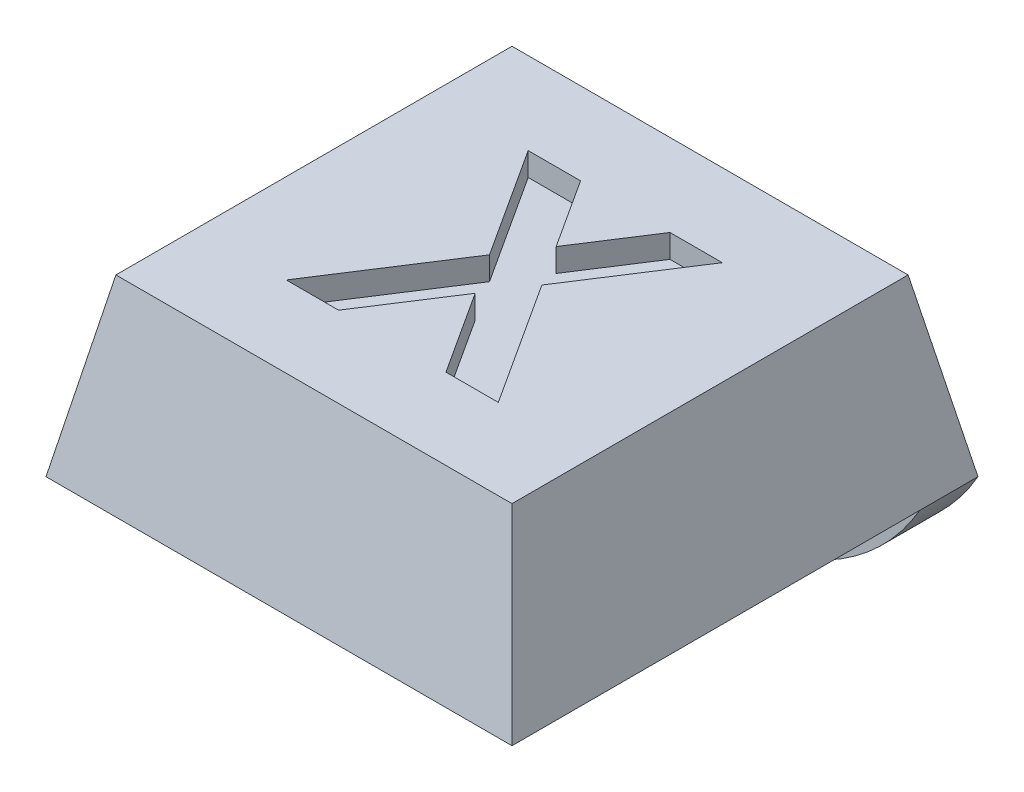
from build123d import *

# Parameters (mm, degrees)
SKETCH1_W               = 8
SKETCH1_H               = 8
BOSS_EXTRUDE1_DEPTH     = 3
CUT_EXTRUDE1_DEPTH      = 12.704699911
CUT_EXTRUDE1_DEPTH_BACK = 12.704699911
CUT_EXTRUDE2_DEPTH      = 11
SKETCH4_R               = 1.8
CUT_EXTRUDE3_DEPTH      = 0.8
SKETCH5_W               = 8
SKETCH5_H               = 1
BOSS_EXTRUDE2_DEPTH     = 2
FILLET1_R               = 4
CUT_EXTRUDE4_DEPTH      = 0.4


with BuildPart() as part:
    # Sketch1 → Boss-Extrude1 (new body)
    with BuildSketch(Plane(origin=(0, 0, 0), x_dir=(1, 0, 0), z_dir=(0, 1, 0))):
        with Locations((4, 4)):
            Rectangle(SKETCH1_W, SKETCH1_H)
    extrude(amount=BOSS_EXTRUDE1_DEPTH)

    # Sketch2 → Cut-Extrude1 (cut, two sides: drawn at the far end of the back side and taken through both)
    with BuildSketch(Plane.XY.offset(-CUT_EXTRUDE1_DEPTH_BACK)):
        Polygon((0, 0), (0.6, 3), (0, 3), align=None)
        Polygon((8, 0), (7.4, 3), (8, 3), align=None)
    extrude(amount=CUT_EXTRUDE1_DEPTH + CUT_EXTRUDE1_DEPTH_BACK, mode=Mode.SUBTRACT)

    # Sketch3 → Cut-Extrude2 (cut)
    with BuildSketch(Plane(origin=(0, 0, 0), x_dir=(0, 0, -1), z_dir=(1, 0, 0))):
        Polygon((0, 0), (0.6, 3), (0, 3), align=None)
        Polygon((8, 3), (7.4, 3), (8, 0), align=None)
    extrude(amount=CUT_EXTRUDE2_DEPTH, mode=Mode.SUBTRACT)

    # Sketch4 → Cut-Extrude3 (cut)
    with BuildSketch(Plane.XZ):
        with Locations(Location((4, -3.75, 0), (0, 0, 270))):
            Circle(SKETCH4_R)
    extrude(amount=-CUT_EXTRUDE3_DEPTH, mode=Mode.SUBTRACT)

    # Sketch5 → Boss-Extrude2 (add)
    with BuildSketch(Plane.XZ):
        with Locations((4, -7.5)):
            Rectangle(SKETCH5_W, SKETCH5_H)
    extrude(amount=BOSS_EXTRUDE2_DEPTH)

    # Fillet1
    # the kernel refuses this fillet: 4 mm, written as the material it takes off along each edge
    with BuildSketch(Plane(origin=(8, -2, -16.660254038), x_dir=(0, 1, 0), z_dir=(0, 0, 1)), Plane(origin=(0, -2, 1.660254038), x_dir=(0, 1, 0), z_dir=(0, 0, -1))) as fillet1_piece_1:
        with BuildLine():
            CenterArc((4, 3.464101615), FILLET1_R, 180, 60)
            Line((0, 3.464101615), (-0.08, 3.464101615))
            Line((-0.08, 3.464101615), (-0.08, 0))
            Line((-0.08, 0), (0, -0.08))
            ThreePointArc((0, -0.08), (1, -0.08), (1.96, -0.069282032))
            Line((1.96, -0.069282032), (2, 0))
        make_face()
    extrude(amount=18.320508076, mode=Mode.SUBTRACT)

    # Sketch6 → Cut-Extrude4 (cut)
    with BuildSketch(Plane(origin=(0, 3, 0), x_dir=(1, 0, 0), z_dir=(0, 1, 0))):
        Polygon((2.136477101, 1.987434605), (3.507470691, 4.106024349), (2.290323255, 5.987434605), (3.189361717, 5.987434605), (3.956989922, 4.800735887), (4.724618127, 5.987434605), (5.623656589, 5.987434605), (4.406509153, 4.106024349), (5.777502742, 1.987434605), (4.878464281, 1.987434605), (3.956989922, 3.41131281), (3.035515563, 1.987434605), align=None)
    extrude(amount=-CUT_EXTRUDE4_DEPTH, mode=Mode.SUBTRACT)


solid = part.part
